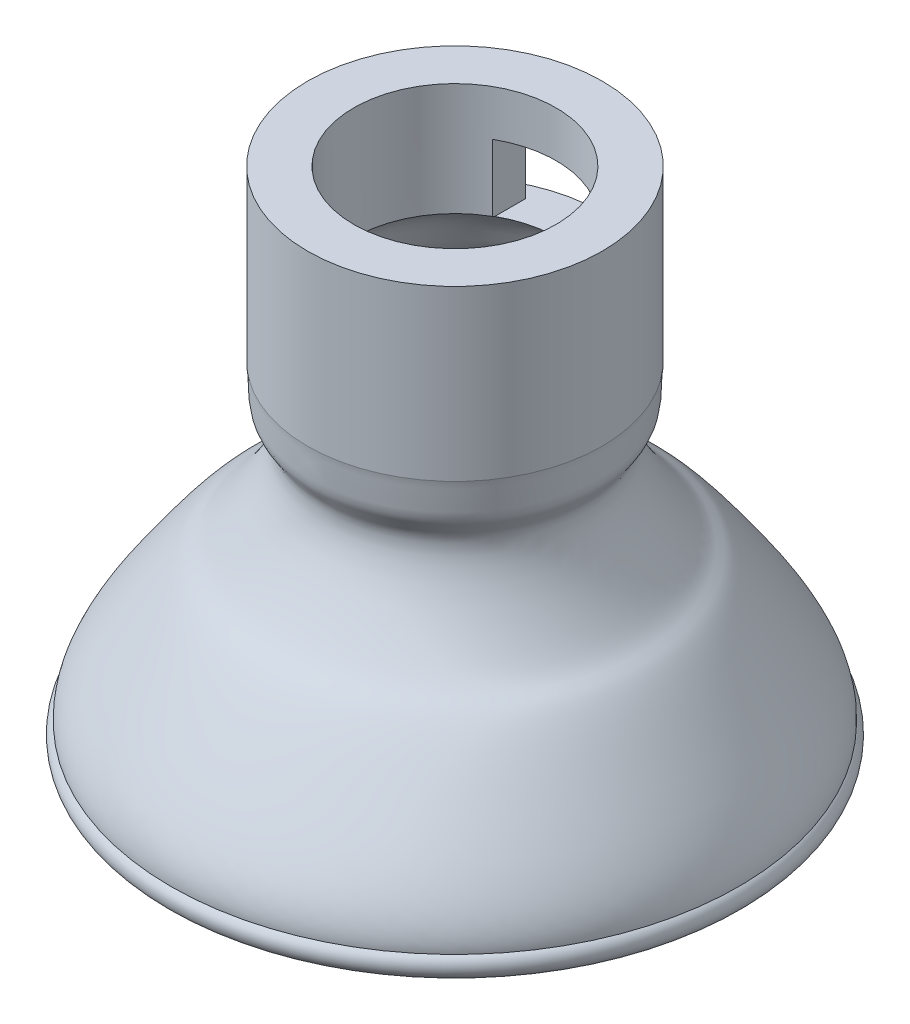
from build123d import *

# Parameters (mm, degrees)
ESBO_O2_W                  = 8.52075949
ESBO_O2_H                  = 5.764043184
CORTE_EXTRUS_O1_DEPTH      = 21
CORTE_EXTRUS_O2_DEPTH      = 21
CORTE_EXTRUS_O2_DEPTH_BACK = 21
ESBO_O3_W                  = 2.243810292
ESBO_O3_H                  = 5.764043184


with BuildPart() as part:
    # Esboço1 → Revolução1 (revolve)
    with BuildSketch(Plane.XY):
        with BuildLine():
            Line((23.613794, 12.965836426), (23.179763003, 12.965836426))
            ThreePointArc((23.179763003, 12.965836426), (22.305060162, 13.890111929), (22.883592364, 15.023553924))
            add(Edge.make_bspline(
                [(11.307306068, 41.640757561), (11.273508042, 41.419087908), (11.225101504, 40.957376107), (11.193026279, 40.152209665), (11.194025164, 39.304088475), (11.110574296, 38.777078707), (11.029809991, 38.585113078), (10.875626346, 38.330661384), (10.632782714, 37.993206106), (10.337880773, 37.554240715), (10.043589267, 36.9656871), (9.826027372, 36.007636699), (9.914556574, 34.890335952), (10.296489153, 33.575292999), (10.86389191, 32.293618099), (11.759071388, 30.664468375), (12.946367341, 28.919920551), (13.948802762, 27.69653267), (14.801409404, 26.960382807), (15.418667293, 26.577059231), (15.841844965, 26.255748079), (16.589552393, 25.48932973), (17.62963193, 24.220510979), (19.000727557, 22.369544481), (20.544370852, 20.200784471), (21.712928806, 18.335896373), (22.302975554, 17.206719637), (22.637852499, 16.382278959), (22.808730433, 15.829198344), (22.890769285, 15.346757355), (22.894284366, 15.140423019), (22.883592364, 15.023553924)],
                knots=[0, 0, 0, 0, 0.015625, 0.03125, 0.0625, 0.09375, 0.109375, 0.125, 0.140625, 0.15625, 0.171875, 0.1875, 0.21875, 0.25, 0.28125, 0.3125, 0.375, 0.4375, 0.5, 0.5625, 0.625, 0.6875, 0.75, 0.8125, 0.875, 0.90625, 0.9375, 0.953125, 0.96875, 0.984375, 1, 1, 1, 1], degree=3))
            add(Edge.make_bspline(
                [(11.307306068, 41.640757561), (10.493329038, 43.239681157), (10.332192588, 45.29403191), (8.575926678, 46.236967031)],
                knots=[0, 0, 0, 0, 1, 1, 1, 1], degree=3))
            Line((8.575926678, 46.236967031), (8.575926678, 55.780385677))
            Line((8.575926678, 55.780385677), (12.493596339, 55.780385677))
            Line((12.493596339, 55.780385677), (12.493596339, 46.236967031))
            Line((12.493596339, 46.236967031), (12.493596339, 41.646579704))
            Line((12.493596339, 41.646579704), (12.493596339, 41.459883591))
            add(Edge.make_bspline(
                [(12.493596339, 41.459883591), (12.301263403, 40.198437894), (12.672676028, 38.232307085), (9.898226855, 35.869637873), (14.859497628, 27.808367469), (16.089859378, 28.020832476), (19.354182401, 24.142981418), (24.256577419, 16.859591957), (24.078601749, 14.91422611)],
                knots=[0, 0, 0, 0, 0.101004703, 0.175039834, 0.372875088, 0.603292123, 0.835962091, 1, 1, 1, 1], degree=3))
            ThreePointArc((24.078601749, 14.91422611), (24.469640731, 13.79130277), (23.613794, 12.965836426))
        make_face()
    revolve(axis=Axis((0, 44.517371893, 0), (0, -1, 0)))

    # Esboço2 → Corte-extrusão1 (cut)
    with BuildSketch(Plane.XY):
        with Locations((0, 49.017313479)):
            Rectangle(ESBO_O2_W, ESBO_O2_H)
    extrude(amount=-CORTE_EXTRUS_O1_DEPTH, mode=Mode.SUBTRACT)

    # Esboço3 → Corte-extrusão2 (cut, two sides: drawn at the far end of the back side and taken through both)
    with BuildSketch(Plane(origin=(0, 0, 0), x_dir=(0, 0, -1), z_dir=(1, 0, 0)).offset(-CORTE_EXTRUS_O2_DEPTH_BACK)):
        with Locations((11.371691193, 49.017313479)):
            Rectangle(ESBO_O3_W, ESBO_O3_H)
    extrude(amount=CORTE_EXTRUS_O2_DEPTH + CORTE_EXTRUS_O2_DEPTH_BACK, mode=Mode.SUBTRACT)


solid = part.part
